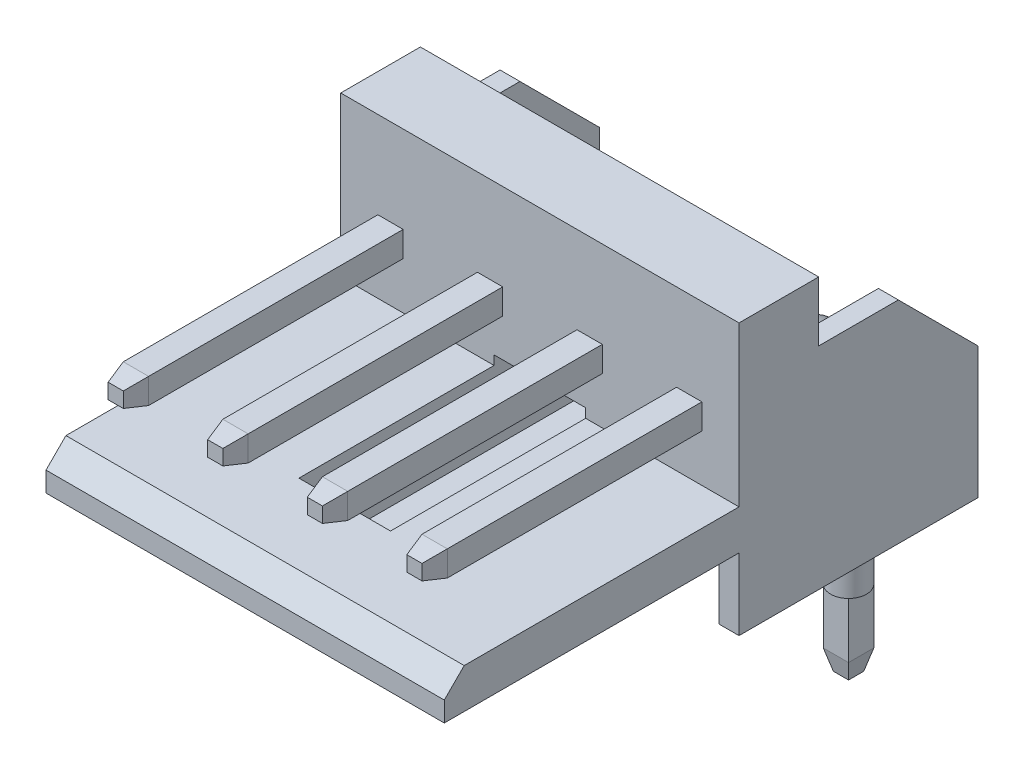
from build123d import *
from OCP.BRepFilletAPI import BRepFilletAPI_MakeChamfer

# Parameters (mm, degrees)
SKETCH1_W                             = 10
SKETCH1_H                             = 4
BODY_BASE_DEPTH                       = 2
SKETCH2_W                             = 0.635
SKETCH2_H                             = 0.635
HORIZONTAL_PINS_DEPTH                 = 6.9
SKETCH3_W                             = 10
SKETCH3_H                             = 9.4
BODY_HORIZONTAL_SHELF_DEPTH           = 1
MATING_CONNECTOR_LEAD_IN_CHAMFER_SIZE = 0.5
SKETCH4_W                             = 0.5
SKETCH4_H                             = 6
BODY_SIDEWALLS_DEPTH                  = 6.8
BODY_SIDEWALL_MATERIA_REMOVALL_DEPTH  = 7.21
LOCKING_TROUGH_EXTERIOR_DEPTH         = 7
LOCKING_TROUGH_CHAMFER_EXTERIOR_SIZE  = 1.27
LOCKING_TROUGH_MATERIAL_REMOVAL_DEPTH = 1.15
REMAINDER_OF_PIN_DEPTH                = 0.635
LPATTERN_COMPLEMENT_OF_PINS_COUNT     = 4
LPATTERN_COMPLEMENT_OF_PINS_PITCH     = 2.5
PIN_CHAMFER1_SIZE                     = 0.508
PIN_CHAMFER1_SIZE2                    = 0.127
PIN_CHAMFER2_SIZE                     = 0.127
PIN_CHAMFER2_SIZE2                    = 0.508
SKETCH11_R                            = 0.449012806
PIN_1_MARKING_AND_MATE_AIDE_DEPTH     = 1.5


with BuildPart() as part:
    # Sketch1 → Body base (new body)
    with BuildSketch(Plane.XY):
        with Locations((0, 2)):
            Rectangle(SKETCH1_W, SKETCH1_H)
    extrude(amount=-BODY_BASE_DEPTH)

    # Sketch2 → Horizontal pins (add)
    with BuildSketch(Plane.XY):
        with Locations((-3.75, 1.5)):
            Rectangle(SKETCH2_W, SKETCH2_H)
        with Locations((-1.25, 1.5)):
            Rectangle(SKETCH2_W, SKETCH2_H)
        with Locations((1.25, 1.5)):
            Rectangle(SKETCH2_W, SKETCH2_H)
        with Locations((3.75, 1.5)):
            Rectangle(SKETCH2_W, SKETCH2_H)
    extrude(amount=HORIZONTAL_PINS_DEPTH)

    # Sketch3 → Body - horizontal shelf (add)
    with BuildSketch(Plane.XZ):
        with Locations((0, 2.7)):
            Rectangle(SKETCH3_W, SKETCH3_H)
    extrude(amount=BODY_HORIZONTAL_SHELF_DEPTH)

    # Mating connector lead-in chamfer
    mating_connector_lead_in_chamfer_edges = [part.edges().sort_by_distance(p)[0] for p in [
        (0, 0, 7.4),
    ]]
    chamfer(mating_connector_lead_in_chamfer_edges, length=MATING_CONNECTOR_LEAD_IN_CHAMFER_SIZE)

    # Sketch4 → Body sidewalls (add)
    with BuildSketch(Plane(origin=(0, 4, 0), x_dir=(1, 0, 0), z_dir=(0, 1, 0))):
        with Locations((-4.75, 3)):
            Rectangle(SKETCH4_W, SKETCH4_H)
        with Locations((4.75, 3)):
            Rectangle(SKETCH4_W, SKETCH4_H)
    extrude(amount=-BODY_SIDEWALLS_DEPTH)

    # Sketch5 → Body sidewall - materia removall (cut, symmetric)
    with BuildSketch(Plane(origin=(0, 0, 0), x_dir=(0, 0, -1), z_dir=(1, 0, 0))):
        Polygon((2, 4), (2, 2.5), (4, 2.5), (6, 0.5), (6, 4), align=None)
    extrude(amount=BODY_SIDEWALL_MATERIA_REMOVALL_DEPTH, both=True, mode=Mode.SUBTRACT)

    # Sketch6 → Locking trough - exterior (add)
    with BuildSketch(Plane(origin=(0, 0, -2), x_dir=(-1, 0, 0), z_dir=(0, 0, -1))):
        Polygon((-2, -1), (-1.266765158, -2.27), (1.266765158, -2.27), (2, -1), align=None)
    extrude(amount=-LOCKING_TROUGH_EXTERIOR_DEPTH)

    # Locking trough chamfer - exterior
    locking_trough_chamfer_exterior_edges = [part.edges().sort_by_distance(p)[0] for p in [
        (0, -2.27, 5),
    ]]
    chamfer(locking_trough_chamfer_exterior_edges, length=LOCKING_TROUGH_CHAMFER_EXTERIOR_SIZE - 0.0001)  # a hair under: the kernel refuses the full size

    # Sketch8 → Locking trough - material removal (cut, symmetric)
    with BuildSketch(Plane(origin=(0, 0, 0), x_dir=(0, 0, -1), z_dir=(1, 0, 0))):
        Polygon((-4.9, 0), (-3.13, -1.77), (6, -1.77), (6, 0.23), (0, 0.23), (0, 0), align=None)
    extrude(amount=LOCKING_TROUGH_MATERIAL_REMOVAL_DEPTH, both=True, mode=Mode.SUBTRACT)

    # Sketch9 → Remainder of pin (add)
    with BuildSketch(Plane(origin=(4.0675, 0, 0), x_dir=(0, 0, -1), z_dir=(1, 0, 0))):
        with BuildLine():
            Line((2, 1.8175), (2.8175, 1.8175))
            ThreePointArc((2.8175, 1.8175), (3.878160172, 1.378160172), (4.3175, 0.3175))
            Line((4.3175, 0.3175), (4.3175, -6.2))
            Line((4.3175, -6.2), (3.6825, -6.2))
            Line((3.6825, -6.2), (3.6825, 0.3175))
            ThreePointArc((3.6825, 0.3175), (3.429147366, 0.929147366), (2.8175, 1.1825))
            Line((2.8175, 1.1825), (2, 1.1825))
            Line((2, 1.1825), (2, 1.8175))
        make_face()
    remainder_of_pin = extrude(amount=-REMAINDER_OF_PIN_DEPTH)

    # LPattern - complement  of pins: Remainder of pin ×4
    with Locations(*[(-i * LPATTERN_COMPLEMENT_OF_PINS_PITCH, 0, 0) for i in range(1, LPATTERN_COMPLEMENT_OF_PINS_COUNT)]):
        add(remainder_of_pin)

    # Pin chamfer1: one chamfer whose edges measure the first distance from different faces: ONE call of the kernel's chamfer builder (chamfer() names one face for all edges)
    pin_chamfer1_edges_1 = [part.edges().sort_by_distance(p)[0] for p in [
        (-4.0675, 1.5, 6.9),
    ]]
    pin_chamfer1_side_1 = [part.faces().sort_by_distance(p)[0] for p in [
        (-4.0675, 1.5, 3.45),
    ]]
    pin_chamfer1_edges_2 = [part.edges().sort_by_distance(p)[0] for p in [
        (-3.75, 1.1825, 6.9),
    ]]
    pin_chamfer1_side_2 = [part.faces().sort_by_distance(p)[0] for p in [
        (-3.75, 1.1825, 3.45),
    ]]
    pin_chamfer1_edges_3 = [part.edges().sort_by_distance(p)[0] for p in [
        (-3.4325, 1.5, 6.9),
    ]]
    pin_chamfer1_side_3 = [part.faces().sort_by_distance(p)[0] for p in [
        (-3.4325, 1.5, 3.45),
    ]]
    pin_chamfer1_edges_4 = [part.edges().sort_by_distance(p)[0] for p in [
        (-3.75, 1.8175, 6.9),
    ]]
    pin_chamfer1_side_4 = [part.faces().sort_by_distance(p)[0] for p in [
        (-3.75, 1.8175, 3.45),
    ]]
    pin_chamfer1_edges_5 = [part.edges().sort_by_distance(p)[0] for p in [
        (-1.5675, 1.5, 6.9),
    ]]
    pin_chamfer1_side_5 = [part.faces().sort_by_distance(p)[0] for p in [
        (-1.5675, 1.5, 3.45),
    ]]
    pin_chamfer1_edges_6 = [part.edges().sort_by_distance(p)[0] for p in [
        (-1.25, 1.1825, 6.9),
    ]]
    pin_chamfer1_side_6 = [part.faces().sort_by_distance(p)[0] for p in [
        (-1.25, 1.1825, 3.45),
    ]]
    pin_chamfer1_edges_7 = [part.edges().sort_by_distance(p)[0] for p in [
        (-0.9325, 1.5, 6.9),
    ]]
    pin_chamfer1_side_7 = [part.faces().sort_by_distance(p)[0] for p in [
        (-0.9325, 1.5, 3.45),
    ]]
    pin_chamfer1_edges_8 = [part.edges().sort_by_distance(p)[0] for p in [
        (-1.25, 1.8175, 6.9),
    ]]
    pin_chamfer1_side_8 = [part.faces().sort_by_distance(p)[0] for p in [
        (-1.25, 1.8175, 3.45),
    ]]
    pin_chamfer1_edges_9 = [part.edges().sort_by_distance(p)[0] for p in [
        (0.9325, 1.5, 6.9),
    ]]
    pin_chamfer1_side_9 = [part.faces().sort_by_distance(p)[0] for p in [
        (0.9325, 1.5, 3.45),
    ]]
    pin_chamfer1_edges_10 = [part.edges().sort_by_distance(p)[0] for p in [
        (1.25, 1.1825, 6.9),
    ]]
    pin_chamfer1_side_10 = [part.faces().sort_by_distance(p)[0] for p in [
        (1.25, 1.1825, 3.45),
    ]]
    pin_chamfer1_edges_11 = [part.edges().sort_by_distance(p)[0] for p in [
        (1.5675, 1.5, 6.9),
    ]]
    pin_chamfer1_side_11 = [part.faces().sort_by_distance(p)[0] for p in [
        (1.5675, 1.5, 3.45),
    ]]
    pin_chamfer1_edges_12 = [part.edges().sort_by_distance(p)[0] for p in [
        (1.25, 1.8175, 6.9),
    ]]
    pin_chamfer1_side_12 = [part.faces().sort_by_distance(p)[0] for p in [
        (1.25, 1.8175, 3.45),
    ]]
    pin_chamfer1_edges_13 = [part.edges().sort_by_distance(p)[0] for p in [
        (3.4325, 1.5, 6.9),
    ]]
    pin_chamfer1_side_13 = [part.faces().sort_by_distance(p)[0] for p in [
        (3.4325, 1.5, 3.45),
    ]]
    pin_chamfer1_edges_14 = [part.edges().sort_by_distance(p)[0] for p in [
        (3.75, 1.1825, 6.9),
    ]]
    pin_chamfer1_side_14 = [part.faces().sort_by_distance(p)[0] for p in [
        (3.75, 1.1825, 3.45),
    ]]
    pin_chamfer1_edges_15 = [part.edges().sort_by_distance(p)[0] for p in [
        (4.0675, 1.5, 6.9),
    ]]
    pin_chamfer1_side_15 = [part.faces().sort_by_distance(p)[0] for p in [
        (4.0675, 1.5, 3.45),
    ]]
    pin_chamfer1_edges_16 = [part.edges().sort_by_distance(p)[0] for p in [
        (3.75, 1.8175, 6.9),
    ]]
    pin_chamfer1_side_16 = [part.faces().sort_by_distance(p)[0] for p in [
        (3.75, 1.8175, 3.45),
    ]]
    pin_chamfer1 = BRepFilletAPI_MakeChamfer(part.part.solid().wrapped)
    for e in pin_chamfer1_edges_1:
        pin_chamfer1.Add(PIN_CHAMFER1_SIZE, PIN_CHAMFER1_SIZE2, e.wrapped, pin_chamfer1_side_1[0].wrapped)  # the first distance lies on this face
    for e in pin_chamfer1_edges_2:
        pin_chamfer1.Add(PIN_CHAMFER1_SIZE, PIN_CHAMFER1_SIZE2, e.wrapped, pin_chamfer1_side_2[0].wrapped)  # the first distance lies on this face
    for e in pin_chamfer1_edges_3:
        pin_chamfer1.Add(PIN_CHAMFER1_SIZE, PIN_CHAMFER1_SIZE2, e.wrapped, pin_chamfer1_side_3[0].wrapped)  # the first distance lies on this face
    for e in pin_chamfer1_edges_4:
        pin_chamfer1.Add(PIN_CHAMFER1_SIZE, PIN_CHAMFER1_SIZE2, e.wrapped, pin_chamfer1_side_4[0].wrapped)  # the first distance lies on this face
    for e in pin_chamfer1_edges_5:
        pin_chamfer1.Add(PIN_CHAMFER1_SIZE, PIN_CHAMFER1_SIZE2, e.wrapped, pin_chamfer1_side_5[0].wrapped)  # the first distance lies on this face
    for e in pin_chamfer1_edges_6:
        pin_chamfer1.Add(PIN_CHAMFER1_SIZE, PIN_CHAMFER1_SIZE2, e.wrapped, pin_chamfer1_side_6[0].wrapped)  # the first distance lies on this face
    for e in pin_chamfer1_edges_7:
        pin_chamfer1.Add(PIN_CHAMFER1_SIZE, PIN_CHAMFER1_SIZE2, e.wrapped, pin_chamfer1_side_7[0].wrapped)  # the first distance lies on this face
    for e in pin_chamfer1_edges_8:
        pin_chamfer1.Add(PIN_CHAMFER1_SIZE, PIN_CHAMFER1_SIZE2, e.wrapped, pin_chamfer1_side_8[0].wrapped)  # the first distance lies on this face
    for e in pin_chamfer1_edges_9:
        pin_chamfer1.Add(PIN_CHAMFER1_SIZE, PIN_CHAMFER1_SIZE2, e.wrapped, pin_chamfer1_side_9[0].wrapped)  # the first distance lies on this face
    for e in pin_chamfer1_edges_10:
        pin_chamfer1.Add(PIN_CHAMFER1_SIZE, PIN_CHAMFER1_SIZE2, e.wrapped, pin_chamfer1_side_10[0].wrapped)  # the first distance lies on this face
    for e in pin_chamfer1_edges_11:
        pin_chamfer1.Add(PIN_CHAMFER1_SIZE, PIN_CHAMFER1_SIZE2, e.wrapped, pin_chamfer1_side_11[0].wrapped)  # the first distance lies on this face
    for e in pin_chamfer1_edges_12:
        pin_chamfer1.Add(PIN_CHAMFER1_SIZE, PIN_CHAMFER1_SIZE2, e.wrapped, pin_chamfer1_side_12[0].wrapped)  # the first distance lies on this face
    for e in pin_chamfer1_edges_13:
        pin_chamfer1.Add(PIN_CHAMFER1_SIZE, PIN_CHAMFER1_SIZE2, e.wrapped, pin_chamfer1_side_13[0].wrapped)  # the first distance lies on this face
    for e in pin_chamfer1_edges_14:
        pin_chamfer1.Add(PIN_CHAMFER1_SIZE, PIN_CHAMFER1_SIZE2, e.wrapped, pin_chamfer1_side_14[0].wrapped)  # the first distance lies on this face
    for e in pin_chamfer1_edges_15:
        pin_chamfer1.Add(PIN_CHAMFER1_SIZE, PIN_CHAMFER1_SIZE2, e.wrapped, pin_chamfer1_side_15[0].wrapped)  # the first distance lies on this face
    for e in pin_chamfer1_edges_16:
        pin_chamfer1.Add(PIN_CHAMFER1_SIZE, PIN_CHAMFER1_SIZE2, e.wrapped, pin_chamfer1_side_16[0].wrapped)  # the first distance lies on this face
    add(Compound.cast(pin_chamfer1.Shape()), mode=Mode.REPLACE)

    # Pin chamfer2: one chamfer whose edges measure the first distance from different faces: ONE call of the kernel's chamfer builder (chamfer() names one face for all edges)
    pin_chamfer2_edges_1 = [part.edges().sort_by_distance(p)[0] for p in [
        (3.4325, -6.2, -4),
        (3.75, -6.2, -4.3175),
        (3.75, -6.2, -3.6825),
        (4.0675, -6.2, -4),
    ]]
    pin_chamfer2_side_1 = [part.faces().sort_by_distance(p)[0] for p in [
        (3.75, -6.2, -4),
    ]]
    pin_chamfer2_edges_2 = [part.edges().sort_by_distance(p)[0] for p in [
        (0.9325, -6.2, -4),
        (1.25, -6.2, -4.3175),
        (1.25, -6.2, -3.6825),
        (1.5675, -6.2, -4),
    ]]
    pin_chamfer2_side_2 = [part.faces().sort_by_distance(p)[0] for p in [
        (1.25, -6.2, -4),
    ]]
    pin_chamfer2_edges_3 = [part.edges().sort_by_distance(p)[0] for p in [
        (-1.5675, -6.2, -4),
        (-1.25, -6.2, -4.3175),
        (-1.25, -6.2, -3.6825),
        (-0.9325, -6.2, -4),
    ]]
    pin_chamfer2_side_3 = [part.faces().sort_by_distance(p)[0] for p in [
        (-1.25, -6.2, -4),
    ]]
    pin_chamfer2_edges_4 = [part.edges().sort_by_distance(p)[0] for p in [
        (-4.0675, -6.2, -4),
        (-3.75, -6.2, -4.3175),
        (-3.75, -6.2, -3.6825),
        (-3.4325, -6.2, -4),
    ]]
    pin_chamfer2_side_4 = [part.faces().sort_by_distance(p)[0] for p in [
        (-3.75, -6.2, -4),
    ]]
    pin_chamfer2 = BRepFilletAPI_MakeChamfer(part.part.solid().wrapped)
    for e in pin_chamfer2_edges_1:
        pin_chamfer2.Add(PIN_CHAMFER2_SIZE, PIN_CHAMFER2_SIZE2, e.wrapped, pin_chamfer2_side_1[0].wrapped)  # the first distance lies on this face
    for e in pin_chamfer2_edges_2:
        pin_chamfer2.Add(PIN_CHAMFER2_SIZE, PIN_CHAMFER2_SIZE2, e.wrapped, pin_chamfer2_side_2[0].wrapped)  # the first distance lies on this face
    for e in pin_chamfer2_edges_3:
        pin_chamfer2.Add(PIN_CHAMFER2_SIZE, PIN_CHAMFER2_SIZE2, e.wrapped, pin_chamfer2_side_3[0].wrapped)  # the first distance lies on this face
    for e in pin_chamfer2_edges_4:
        pin_chamfer2.Add(PIN_CHAMFER2_SIZE, PIN_CHAMFER2_SIZE2, e.wrapped, pin_chamfer2_side_4[0].wrapped)  # the first distance lies on this face
    add(Compound.cast(pin_chamfer2.Shape()), mode=Mode.REPLACE)

    # Sketch11 → Pin 1 marking and mate aide (add)
    with BuildSketch(Plane.XZ.offset(2.8)):
        with Locations(Location((3.75, -4, 0), (0, 0, 135))):
            Circle(SKETCH11_R)
    extrude(amount=PIN_1_MARKING_AND_MATE_AIDE_DEPTH)


solid = part.part
